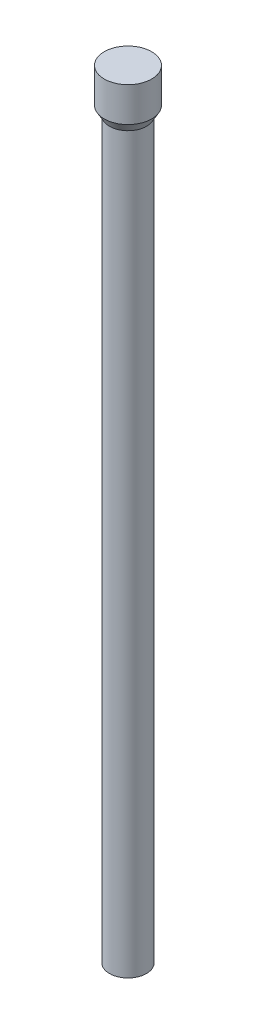
from build123d import *

# Parameters (mm, degrees)
SKETCH_1_R       = 2.5
EXTRUDE_1_DEPTH  = 2
SKETCH_2_R       = 1.95
EXTRUDE_2_DEPTH  = 80
CHAMFER_1_SIZE   = 1.5
CHAMFER_1_SIZE_2 = 2.598076211


with BuildPart() as part:
    # 草图1 → 凸台-拉伸1 (new body)
    with BuildSketch(Plane(origin=(0, 0, 0), x_dir=(1, 0, 0), z_dir=(0, 1, 0))):
        with Locations(Location((0, 0, 0), (0, 0, 270))):
            Circle(SKETCH_1_R)
    extrude(amount=EXTRUDE_1_DEPTH)

    # 草图2 → 凸台-拉伸2 (add)
    with BuildSketch(Plane.XZ):
        with Locations(Location((0, 0, 0), (0, 0, 270))):
            Circle(SKETCH_2_R)
    extrude(amount=EXTRUDE_2_DEPTH)

    # 倒角1
    # the kernel refuses this chamfer: 2.598076211, 1.5 mm, written as the material it adds along each edge
    with BuildSketch(Plane(origin=(0, 0, 0), x_dir=(0, 0, -1), z_dir=(-1, 0, 0))) as chamfer_1_piece_1_section:
        Polygon((1.95 + CHAMFER_1_SIZE, 0), (1.95, CHAMFER_1_SIZE_2), (1.95, 0), align=None)
    chamfer_1_piece_1 = revolve(axis=Axis((0, 0, 0), (0, -1, 0)), mode=Mode.PRIVATE)
    chamfer_1_piece_1 = chamfer_1_piece_1 & Plane(origin=(0, -2.153550613, 0), x_dir=(0, 0, 1), z_dir=(0, -1, 0)) * Cylinder(2.5, 14, mode=Mode.PRIVATE)
    add(chamfer_1_piece_1)


solid = part.part
